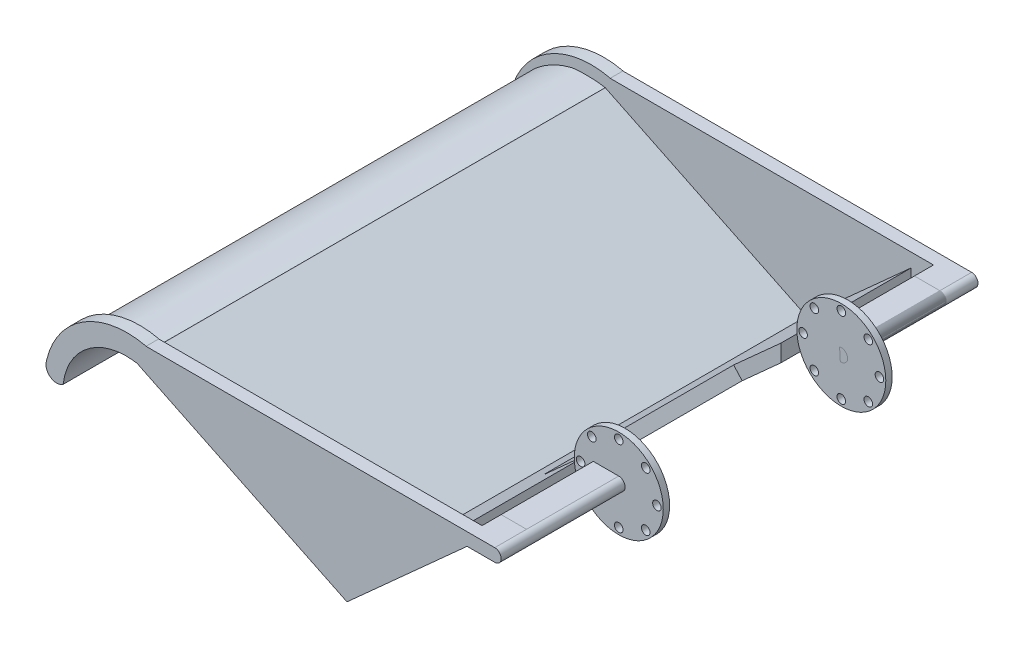
from build123d import *

# Parameters (mm, degrees)
EXTRUDE_1_DEPTH          = 150
CUT_EXTRUDE_START        = -4
CUT_EXTRUDE_1_DEPTH      = 142
EXTRUDE_2_DEPTH          = 10
EXTRUDE_3_DEPTH          = 146
CUT_EXTRUDE_2_DEPTH      = 182.252872433
CUT_EXTRUDE_2_DEPTH_BACK = 182.252872433
SKETCH_13_W              = 7
SKETCH_13_H              = 142
CUT_EXTRUDE_3_DEPTH      = 10
CUT_EXTRUDE_4_DEPTH      = 182.247779062
CUT_EXTRUDE_4_DEPTH_BACK = 182.247779062
CUT_EXTRUDE_5_DEPTH      = 182.247779062
CUT_EXTRUDE_5_DEPTH_BACK = 182.247779062
CUT_EXTRUDE_6_DEPTH      = 183.008664647
CUT_EXTRUDE_6_DEPTH_BACK = 183.008664647
EXTRUDE_4_DEPTH          = 4
EXTRUDE_START            = -150
EXTRUDE_5_DEPTH          = 4
EXTRUDE_6_DEPTH          = 142
EXTRUDE_7_DEPTH          = 31
SKETCH_23_R              = 14
SKETCH_23_R_2            = 1.35
EXTRUDE_8_DEPTH          = 4
SKETCH_24_R              = 2.5
EXTRUDE_9_DEPTH          = 4
SKETCH_25_W              = 20
SKETCH_25_H              = 60
CUT_EXTRUDE_7_DEPTH      = 4
CUT_EXTRUDE_START_2      = -2
SKETCH_27_R              = 14
SKETCH_27_R_2            = 2
CUT_EXTRUDE_8_DEPTH      = 2
SKETCH_28_R              = 14
SKETCH_28_R_2            = 2
CUT_EXTRUDE_9_DEPTH      = 2
EXTRUDE_10_DEPTH         = 4
SWEEP_START              = 4
SWEEP_1_DEPTH            = 142
SWEEP_2_DEPTH            = 142
SWEEP_4_DEPTH            = 142
SWEEP_5_DEPTH            = 142
SWEEP_6_DEPTH            = 142
EXTRUDE_11_DEPTH         = 29
EXTRUDE_12_DEPTH         = 29
EXTRUDE_13_DEPTH         = 150
EXTRUDE_START_2          = 4
EXTRUDE_14_DEPTH         = 142


# Read off the part's stored shape, not the designer's step: 扫描1, 扫描2, 扫描4, 扫描5, 扫描6, 凸台-拉伸13
with BuildPart() as part:
    # 草图1 → 凸台-拉伸1 (new body)
    with BuildSketch(Plane.XY):
        with BuildLine():
            Line((0, 0), (84.371041787, 0))
            add(Edge.make_bspline(
                [(55.913923705, -38.035643557), (80.119272772, -28.628823463), (84.371041787, 0)],
                knots=[0, 0, 0, 1, 1, 1], degree=2))
            Line((55.913923705, -38.035643557), (46.3275244, -38.035643557))
            Line((46.3275244, -38.035643557), (45.93874262, -38.035643557))
            Line((45.93874262, -38.035643557), (-35.628958213, 0))
            Line((-35.628958213, 0), (0, 0))
        make_face()
    extrude(amount=EXTRUDE_1_DEPTH)

    # 草图2 → 切除-拉伸1 (cut)
    with BuildSketch(Plane.XY.offset(150).offset(CUT_EXTRUDE_START)):
        with BuildLine():
            Line((81.371041787, 0), (-28.530353464, 0))
            Line((-28.530353464, 0), (47.917706931, -35.648316013))
            add(Edge.make_bspline(
                [(47.917706931, -35.648316013), (74.149853948, -29.50839386), (81.371041787, 0)],
                knots=[0, 0, 0, 1, 1, 1], degree=2))
        make_face()
    extrude(amount=-CUT_EXTRUDE_1_DEPTH, mode=Mode.SUBTRACT)

    # 草图9 → 凸台-拉伸2 (add)
    with BuildSketch(Plane.XY):
        with BuildLine():
            Line((92.371041787, 0), (84.371041787, 0))
            add(Edge.make_bspline(
                [(83.660125503, -4), (84.066701304, -2.049243485), (84.371041787, 0)],
                knots=[0.928420269, 0.928420269, 0.928420269, 1, 1, 1], degree=2))
            Line((83.660125503, -4), (92.371041787, -4))
            ThreePointArc((92.371041787, -4), (94.371041787, -2), (92.371041787, 0))
        make_face()
    extrude_2 = extrude(amount=EXTRUDE_2_DEPTH)

    # 镜向1: 凸台-拉伸2 across plane
    add(extrude_2.mirror(Plane.XY.offset(75)))

    # 草图10 → 凸台-拉伸3 (add)
    with BuildSketch(Plane.XY.offset(150)):
        Polygon((45.886677586, -38.011365233), (83.660125513, -3.999999952), (82.12466932, 0), (41.948370108, -36.174902295), align=None)
    extrude(amount=-EXTRUDE_3_DEPTH)

    # 草图12 → 切除-拉伸2 (cut, two sides: drawn at the far end of the back side and taken through both)
    with BuildSketch(Plane.XY.offset(150).offset(-CUT_EXTRUDE_2_DEPTH_BACK)):
        Polygon((83.660125513, -3.999999952), (45.886677586, -38.011365233), (45.93874262, -38.035643557), (42.591069021, -42.580909955), (89.03622068, -36.427217632), align=None)
    extrude(amount=CUT_EXTRUDE_2_DEPTH + CUT_EXTRUDE_2_DEPTH_BACK, mode=Mode.SUBTRACT)

    # 草图13 → 切除-拉伸3 (cut)
    with BuildSketch(Plane(origin=(0, 0, 0), x_dir=(1, 0, 0), z_dir=(0, 1, 0))):
        with Locations((80.871041787, -75)):
            Rectangle(SKETCH_13_W, SKETCH_13_H)
    extrude(amount=-CUT_EXTRUDE_3_DEPTH, mode=Mode.SUBTRACT)

    # 草图15 → 切除-拉伸4 (cut, two sides: drawn at the far end of the back side and taken through both)
    with BuildSketch(Plane.XY.offset(150).offset(-CUT_EXTRUDE_4_DEPTH_BACK)):
        Polygon((-25.628958213, 0), (-25.628958213, -4.663076582), (-35.628958213, 0), align=None)
    extrude(amount=CUT_EXTRUDE_4_DEPTH + CUT_EXTRUDE_4_DEPTH_BACK, mode=Mode.SUBTRACT)

    # 草图17 → 切除-拉伸5 (cut, two sides: drawn at the far end of the back side and taken through both)
    with BuildSketch(Plane.XY.offset(150).offset(-CUT_EXTRUDE_5_DEPTH_BACK)):
        Polygon((45.886677586, -38.011365233), (-32.628958213, 0), (-39.208724499, 3.812604094), (-30.674699475, -18.213608816), align=None)
    extrude(amount=CUT_EXTRUDE_5_DEPTH + CUT_EXTRUDE_5_DEPTH_BACK, mode=Mode.SUBTRACT)

    # 草图19 → 切除-拉伸6 (cut, two sides: drawn at the far end of the back side and taken through both)
    with BuildSketch(Plane(origin=(-5.095697879, -10.927759366, 0), x_dir=(0.9063077870366788, -0.42261826174063777, 0), z_dir=(0.42261826174063777, 0.9063077870366788, 0)).offset(-CUT_EXTRUDE_6_DEPTH_BACK)):
        Polygon((-15.723057795, -4), (-15.723057795, 15.181197201), (-71.912310166, 15.181197201), (-28.952648141, -153.791833671), (-15.723057795, -153.791833671), align=None)
    extrude(amount=CUT_EXTRUDE_6_DEPTH + CUT_EXTRUDE_6_DEPTH_BACK, mode=Mode.SUBTRACT)

    # 草图20 → 凸台-拉伸4 (add)
    with BuildSketch(Plane(origin=(0, 0, 0), x_dir=(-1, 0, 0), z_dir=(0, 0, -1))):
        with BuildLine():
            Line((17.34847479, 0), (20.162737711, -6.03520631))
            add(Edge.make_bspline(
                [(20.162737711, -6.03520631), (22.66067339, -5.652547732), (27.363174773, -5.662392353), (30.160749267, -6.292319916), (35.979648976, -8.083174558), (40.608616668, -12.707453996)],
                knots=[0, 0, 0, 0, 0.459648514, 0.559648514, 1, 1, 1, 1], degree=3))
            add(Edge.make_bspline(
                [(17.34847479, 0), (19.92205597, 0), (24.300461519, 0.17777387), (32.199837859, -1.721775175), (39.374446968, -6.481992043), (40.608616668, -12.707453996)],
                knots=[0, 0, 0, 0, 0.365909974, 0.465909974, 1, 1, 1, 1], degree=3))
        make_face()
    extrude(amount=-EXTRUDE_4_DEPTH)

    # 草图20<2> → 凸台-拉伸5 (add)
    with BuildSketch(Plane(origin=(0, 0, 0), x_dir=(-1, 0, 0), z_dir=(0, 0, -1)).offset(EXTRUDE_START)):
        with BuildLine():
            add(Edge.make_bspline(
                [(17.34847479, 0), (19.92205597, 0), (24.300461519, 0.17777387), (32.199837859, -1.721775175), (39.374446968, -6.481992043), (40.608616668, -12.707453996)],
                knots=[0, 0, 0, 0, 0.365909974, 0.465909974, 1, 1, 1, 1], degree=3))
            Line((17.34847479, 0), (20.162737711, -6.03520631))
            add(Edge.make_bspline(
                [(20.162737711, -6.03520631), (22.66067339, -5.652547732), (27.363174773, -5.662392353), (30.160749267, -6.292319916), (35.979648976, -8.083174558), (40.608616668, -12.707453996)],
                knots=[0, 0, 0, 0, 0.459648514, 0.559648514, 1, 1, 1, 1], degree=3))
        make_face()
    extrude(amount=EXTRUDE_5_DEPTH)

    # 草图21 → 凸台-拉伸6 (add)
    with BuildSketch(Plane.XY.offset(4)):
        Polygon((45.886677586, -38.011365233), (48.294049161, -35.843758131), (-18.855499618, -3.334997324), (-20.162737711, -6.03520631), align=None)
    extrude(amount=EXTRUDE_6_DEPTH)


with BuildPart() as body_2:
    # 草图22 → 凸台-拉伸7 (new body)
    with BuildSketch(Plane.XY.offset(10)):
        with BuildLine():
            ThreePointArc((92.371041787, 0), (90.371041787, -2), (92.371041787, -4))
            ThreePointArc((92.371041787, -4), (93.785255349, -3.414213562), (94.371041787, -2))
            ThreePointArc((94.371041787, -2), (93.785255349, -0.585786438), (92.371041787, 0))
        make_face()
    extrude_7 = extrude(amount=EXTRUDE_7_DEPTH)


with BuildPart() as body_3:
    # 草图23 → 凸台-拉伸8 (new body)
    with BuildSketch(Plane.XY.offset(41)):
        with Locations((92.371041787, -2)):
            Circle(SKETCH_23_R)
        with Locations((92.371041787, 10)):
            Circle(SKETCH_23_R_2, mode=Mode.SUBTRACT)
        with Locations((100.856323161, 6.485281374)):
            Circle(SKETCH_23_R_2, mode=Mode.SUBTRACT)
        with Locations((104.371041787, -2)):
            Circle(SKETCH_23_R_2, mode=Mode.SUBTRACT)
        with Locations((100.856323161, -10.485281374)):
            Circle(SKETCH_23_R_2, mode=Mode.SUBTRACT)
        with Locations((92.371041787, -14)):
            Circle(SKETCH_23_R_2, mode=Mode.SUBTRACT)
        with Locations((83.885760413, -10.485281374)):
            Circle(SKETCH_23_R_2, mode=Mode.SUBTRACT)
        with Locations((80.371041787, -2)):
            Circle(SKETCH_23_R_2, mode=Mode.SUBTRACT)
        with Locations((83.885760413, 6.485281374)):
            Circle(SKETCH_23_R_2, mode=Mode.SUBTRACT)
    extrude_8 = extrude(amount=-EXTRUDE_8_DEPTH)

    # 草图28 → 切除-拉伸9 (cut)
    with BuildSketch(Plane(origin=(0, 0, 37), x_dir=(-1, 0, 0), z_dir=(0, 0, -1))):
        with Locations(Location((-92.371041787, -2, 0), (0, 0, 180))):
            Circle(SKETCH_28_R)
        with Locations((-92.371041787, -2)):
            Circle(SKETCH_28_R_2, mode=Mode.SUBTRACT)
    extrude(amount=-CUT_EXTRUDE_9_DEPTH, mode=Mode.SUBTRACT)


with BuildPart() as part_1:
    add(part.part)

    # 镜向2: 凸台-拉伸7 across plane
    add(extrude_7.mirror(Plane.XY.offset(75)))

    # 镜向3: 凸台-拉伸8 across plane
    add(extrude_8.mirror(Plane.XY.offset(75)))

    # 草图25 → 切除-拉伸7 (cut)
    with BuildSketch(Plane(origin=(36.77015192, -40.837390894, 0), x_dir=(0.7431448254773977, 0.6691306063588546, 0), z_dir=(-0.6691306063588546, 0.7431448254773977, 0))):
        with Locations((44.633886256, -75)):
            Rectangle(SKETCH_25_W, SKETCH_25_H)
    extrude(amount=-CUT_EXTRUDE_7_DEPTH, mode=Mode.SUBTRACT)

    # 草图27 → 切除-拉伸8 (cut)
    with BuildSketch(Plane.XY.offset(113).offset(CUT_EXTRUDE_START_2)):
        with Locations((92.371041787, -2)):
            Circle(SKETCH_27_R)
        with Locations((92.371041787, -2)):
            Circle(SKETCH_27_R_2, mode=Mode.SUBTRACT)
    extrude(amount=CUT_EXTRUDE_8_DEPTH, mode=Mode.SUBTRACT)



with BuildPart() as body_4:
    # 草图24 → 凸台-拉伸9 (new body)
    with BuildSketch(Plane.XY.offset(150)):
        with Locations((-46.162737711, -20)):
            Circle(SKETCH_24_R)
    extrude(amount=-EXTRUDE_9_DEPTH)


with BuildPart() as body_5:
    # 镜向5: mirrored copy
    add(body_4.part.mirror(Plane.XY.offset(75)))


with BuildPart() as part_2:
    add(part_1.part)

    add(body_4.part)  # 凸台-拉伸10 merges body 4
    # 草图30 → 凸台-拉伸10 (add)
    with BuildSketch(Plane.XY.offset(150)):
        with BuildLine():
            add(Edge.make_bspline(
                [(-17.361804974, 1.243e-06), (-19.933921762, 0.00047988), (-24.305449129, 0.176574508), (-32.199837859, -1.721775175), (-39.374446968, -6.481992043), (-40.608616668, -12.707453996)],
                knots=[0.000631393, 0.000631393, 0.000631393, 0.000631393, 0.365909974, 0.465909974, 1, 1, 1, 1], degree=3))
            Line((-17.361804974, 1.243e-06), (-17.286541526, 0.044151217))
            ThreePointArc((-17.286541526, 0.044151217), (-36.995473472, -3.185414802), (-48.599294605, -19.440365745))
            ThreePointArc((-48.599294605, -19.440365745), (-46.194749763, -17.500204963), (-43.741310686, -19.37815503))
            ThreePointArc((-43.741310686, -19.37815503), (-42.101235507, -15.27422661), (-39.525601088, -11.682822647))
            add(Edge.make_bspline(
                [(-39.525601088, -11.682822647), (-39.886354477, -12.0058354), (-40.24782898, -12.347031717), (-40.608616668, -12.707453996)],
                knots=[0.96567844, 0.96567844, 0.96567844, 0.96567844, 1, 1, 1, 1], degree=3))
        make_face()
    extrude_10 = extrude(amount=-EXTRUDE_10_DEPTH)

    # 镜向7: 凸台-拉伸10 across plane
    add(extrude_10.mirror(Plane.XY.offset(75)))

    # 扫描1 outline → 扫描1 (add)
    with BuildSketch(Plane.XY.offset(SWEEP_START)):
        with BuildLine():
            Line((-40.359499641, -9.938451278), (-39.525601088, -11.682822647))
            add(Edge.make_bspline(
                [(-39.525601088, -11.682822647), (-37.391713968, -9.772174618), (-35.283057384, -8.497737422), (-31.698971246, -6.78981865), (-30.223541725, -6.356337092), (-28.92883316, -6.014930371), (-28.649075758, -5.951937626), (-27.396040293, -5.780259789), (-25.993917265, -5.718425153), (-23.001749877, -5.750233764), (-21.411705546, -5.843877026), (-20.162737711, -6.03520631)],
                knots=[0, 0, 0, 0, 0.210230398, 0.210230398, 0.420460797, 0.420460797, 0.524014936, 0.524014936, 0.762007468, 0.762007468, 1, 1, 1, 1], degree=3))
            Line((-20.162737711, -6.03520631), (-19.345627594, -4.282908011))
            add(Edge.make_bspline(
                [(-40.359499641, -9.938451278), (-38.03938458, -7.938537704), (-35.747801683, -6.614334919), (-31.851708044, -4.855945924), (-30.234072212, -4.421931688), (-28.847183327, -4.082968243), (-28.444896136, -4.027547987), (-26.923919783, -3.895861941), (-25.495125385, -3.849255475), (-22.376450407, -3.919499158), (-20.725652055, -4.028782308), (-19.345627594, -4.282908011)],
                knots=[0, 0, 0, 0, 0.210230398, 0.210230398, 0.420460797, 0.420460797, 0.524014936, 0.524014936, 0.762007468, 0.762007468, 1, 1, 1, 1], degree=3))
        make_face()
    extrude(amount=SWEEP_1_DEPTH)


    add(body_5.part)  # 扫描2 merges body 5
    # 扫描2 outline → 扫描2 (add)
    with BuildSketch(Plane.XY.offset(SWEEP_START)):
        with BuildLine():
            Line((-45.291038107, -18.222056768), (-43.741310686, -19.37815503))
            ThreePointArc((-43.741310686, -19.37815503), (-42.101235507, -15.274226609), (-39.525601088, -11.682822647))
            Line((-39.525601088, -11.682822647), (-40.359499641, -9.938451278))
            ThreePointArc((-40.359499641, -9.938451278), (-43.328808115, -13.780478383), (-45.291038107, -18.222056768))
        make_face()
    extrude(amount=SWEEP_2_DEPTH)

    # 扫描4 outline → 扫描4 (add)
    with BuildSketch(Plane.XY.offset(SWEEP_START)):
        Polygon((-18.855499618, -3.334997324), (-18.880970466, -3.323120072), (-19.345627594, -4.282908011), (-19.320156747, -4.294785262), align=None)
    extrude(amount=SWEEP_4_DEPTH)

    # 扫描5 outline → 扫描5 (add)
    with BuildSketch(Plane.XY.offset(SWEEP_START)):
        with BuildLine():
            add(Edge.make_bspline(
                [(-40.816256515, -8.974878607), (-38.391889395, -6.925241015), (-36.000392341, -5.574532499), (-32.946671955, -4.23514457), (-32.014835751, -3.903393229), (-30.817762218, -3.5309807), (-30.452065305, -3.42769871), (-29.7998577, -3.254956896), (-29.52566126, -3.185141268), (-29.025880923, -3.073560275), (-28.765000893, -3.034662116), (-28.276124787, -2.975855713), (-28.034143944, -2.956484287), (-26.669625139, -2.858422023), (-25.221818375, -2.817952966), (-22.037290505, -2.907940726), (-20.34677292, -3.0270334), (-18.880970466, -3.323120072)],
                knots=[0, 0, 0, 0, 0.210230398, 0.210230398, 0.315345597, 0.315345597, 0.367903197, 0.367903197, 0.420460797, 0.420460797, 0.472237866, 0.472237866, 0.524014936, 0.524014936, 0.762007468, 0.762007468, 1, 1, 1, 1], degree=3))
            Line((-40.816256515, -8.974878607), (-40.359499641, -9.938451278))
            add(Edge.make_bspline(
                [(-40.359499641, -9.938451278), (-38.03938458, -7.938537704), (-35.747801683, -6.614334919), (-31.851708044, -4.855945924), (-30.234072212, -4.421931688), (-28.847183327, -4.082968243), (-28.444896136, -4.027547987), (-26.923919783, -3.895861941), (-25.495125385, -3.849255475), (-22.376450407, -3.919499158), (-20.725652055, -4.028782308), (-19.345627594, -4.282908011)],
                knots=[0, 0, 0, 0, 0.210230398, 0.210230398, 0.420460797, 0.420460797, 0.524014936, 0.524014936, 0.762007468, 0.762007468, 1, 1, 1, 1], degree=3))
            Line((-19.345627594, -4.282908011), (-18.880970466, -3.323120072))
        make_face()
    extrude(amount=SWEEP_5_DEPTH)

    # 扫描6 outline → 扫描6 (add)
    with BuildSketch(Plane.XY.offset(SWEEP_START)):
        with BuildLine():
            ThreePointArc((-40.816256515, -8.974878607), (-44.003139485, -12.954417649), (-46.143656955, -17.581634849))
            Line((-46.143656955, -17.581634849), (-45.291038107, -18.222056768))
            ThreePointArc((-45.291038107, -18.222056768), (-43.328808115, -13.780478383), (-40.359499641, -9.938451278))
            Line((-40.359499641, -9.938451278), (-40.816256515, -8.974878607))
        make_face()
    extrude(amount=SWEEP_6_DEPTH)

    # 凸台-拉伸13 outline → 凸台-拉伸13 (add)
    with BuildSketch(Plane(origin=(0, 0, 0), x_dir=(-1, 0, 0), z_dir=(0, 0, -1)).offset(EXTRUDE_START)):
        with BuildLine():
            Line((48.599294605, -19.440365745), (43.741310686, -19.37815503))
            ThreePointArc((43.741310686, -19.37815503), (42.101235507, -15.274226609), (39.525601088, -11.682822647))
            add(Edge.make_bspline(
                [(23.720192871, -5.749523832), (25.496241827, -5.698874343), (27.895603388, -5.78227887), (30.064732145, -6.270699819), (35.257826852, -7.861526582), (39.525601088, -11.682822647)],
                knots=[0.19031794, 0.19031794, 0.19031794, 0.19031794, 0.459648514, 0.559648514, 0.96567844, 0.96567844, 0.96567844, 0.96567844], degree=3))
            ThreePointArc((23.720192871, -5.749523832), (36.891719451, -10.861580292), (43.398015701, -23.403124966))
            ThreePointArc((43.398015701, -23.403124966), (47.361193605, -23.452620302), (48.645011049, -19.702814753))
            ThreePointArc((48.645011049, -19.702814753), (48.625651145, -19.570980871), (48.599294605, -19.440365745))
        make_face()
    extrude(amount=EXTRUDE_13_DEPTH)

    # 草图36 → 凸台-拉伸14 (add)
    with BuildSketch(Plane.XY.offset(EXTRUDE_START_2)):
        with BuildLine():
            Line((-46.143656955, -17.581634849), (-43.741310686, -19.37815503))
            Line((-43.741310686, -19.37815503), (-46.645776979, -19.415349251))
            ThreePointArc((-46.645776979, -19.415349251), (-46.415359069, -18.49283969), (-46.143656955, -17.581634849))
        make_face()
    extrude(amount=EXTRUDE_14_DEPTH)


with BuildPart() as body_4_2:
    # 草图33 → 凸台-拉伸11 (new body)
    with BuildSketch(Plane.XY.offset(10)):
        with BuildLine():
            Line((84.371041787, 0), (84.371041787, -4))
            Line((84.371041787, -4), (92.371041787, -4))
            ThreePointArc((92.371041787, -4), (94.371041787, -2), (92.371041787, 0))
            Line((92.371041787, 0), (84.371041787, 0))
        make_face()
    extrude(amount=EXTRUDE_11_DEPTH)


with BuildPart() as body_5_2:
    # 草图34 → 凸台-拉伸12 (new body)
    with BuildSketch(Plane(origin=(0, 0, 140), x_dir=(-1, 0, 0), z_dir=(0, 0, -1))):
        with BuildLine():
            Line((-84.371041787, 0), (-92.371041787, 0))
            ThreePointArc((-92.371041787, 0), (-90.371041787, -2), (-92.371041787, -4))
            Line((-92.371041787, -4), (-84.371041787, -4))
            Line((-84.371041787, -4), (-84.371041787, 0))
        make_face()
    extrude(amount=EXTRUDE_12_DEPTH)


solid = Compound([body_2.part, body_3.part, part_2.part, body_4_2.part, body_5_2.part])
